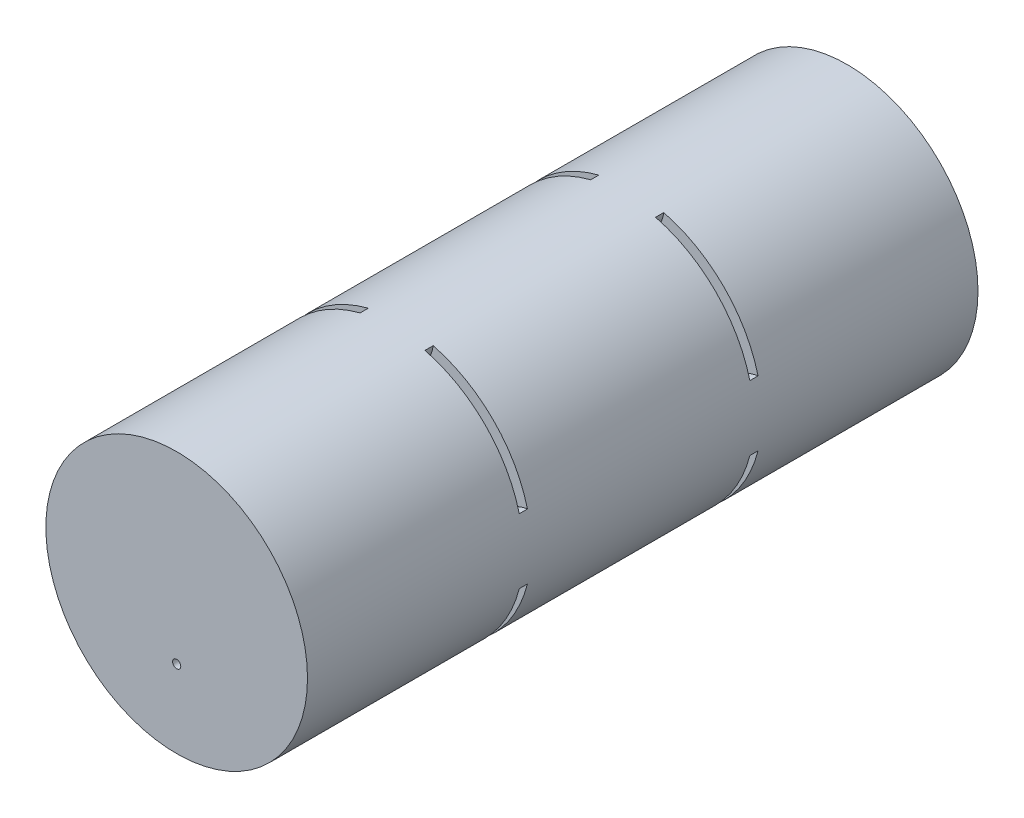
from build123d import *

# Parameters (mm, degrees)
SKETCH1_R           = 50.8
BOSS_EXTRUDE1_DEPTH = 260.35
CUT_EXTRUDE1_START  = -86.995
SKETCH2_R           = 19.05
CUT_EXTRUDE1_DEPTH  = 3.175
CUT_EXTRUDE2_REACH  = 272.08
SKETCH3_R           = 1.5875


with BuildPart() as part:
    # Sketch1 → Boss-Extrude1 (new body)
    with BuildSketch(Plane.XY):
        Circle(SKETCH1_R)
    extrude(amount=BOSS_EXTRUDE1_DEPTH)

    # Sketch2 → Cut-Extrude1 (cut)
    with BuildSketch(Plane.XY.offset(260.35).offset(CUT_EXTRUDE1_START)):
        with BuildLine():
            ThreePointArc((-12.600390619, 49.2125), (-35.921024484, 35.921024484), (-49.2125, 12.600390619))
            ThreePointArc((-49.2125, 12.600390619), (-38.1, 0), (-49.2125, -12.600390619))
            ThreePointArc((-49.2125, -12.600390619), (-35.921024484, -35.921024484), (-12.600390619, -49.2125))
            ThreePointArc((-12.600390619, -49.2125), (0, -38.1), (12.600390619, -49.2125))
            ThreePointArc((12.600390619, -49.2125), (35.921024484, -35.921024484), (49.2125, -12.600390619))
            ThreePointArc((49.2125, -12.600390619), (38.1, 0), (49.2125, 12.600390619))
            ThreePointArc((49.2125, 12.600390619), (35.921024484, 35.921024484), (12.600390619, 49.2125))
            ThreePointArc((12.600390619, 49.2125), (0, 38.1), (-12.600390619, 49.2125))
        make_face()
        Circle(SKETCH2_R, mode=Mode.SUBTRACT)
    cut_extrude1 = extrude(amount=CUT_EXTRUDE1_DEPTH, mode=Mode.SUBTRACT)

    # Sketch3 → Cut-Extrude2 (cut, up to next)
    with BuildSketch(Plane.XY.offset(260.35), mode=Mode.PRIVATE) as cut_extrude2_sk1:
        with Locations((0, -20.6375)):
            Circle(SKETCH3_R)
    cut_extrude2_tool1 = extrude(cut_extrude2_sk1.sketch, amount=-CUT_EXTRUDE2_REACH, mode=Mode.PRIVATE) & part.part
    cut_extrude2 = cut_extrude2_tool1.solids().sort_by_distance((0, -20.6375, 260.35))[0]
    add(cut_extrude2, mode=Mode.SUBTRACT)

    # Mirror1: Cut-Extrude1, Cut-Extrude2 across plane
    add(cut_extrude1.mirror(Plane.XY.offset(130.175)), mode=Mode.SUBTRACT)
    add(cut_extrude2.mirror(Plane.XY.offset(130.175)), mode=Mode.SUBTRACT)


solid = part.part
